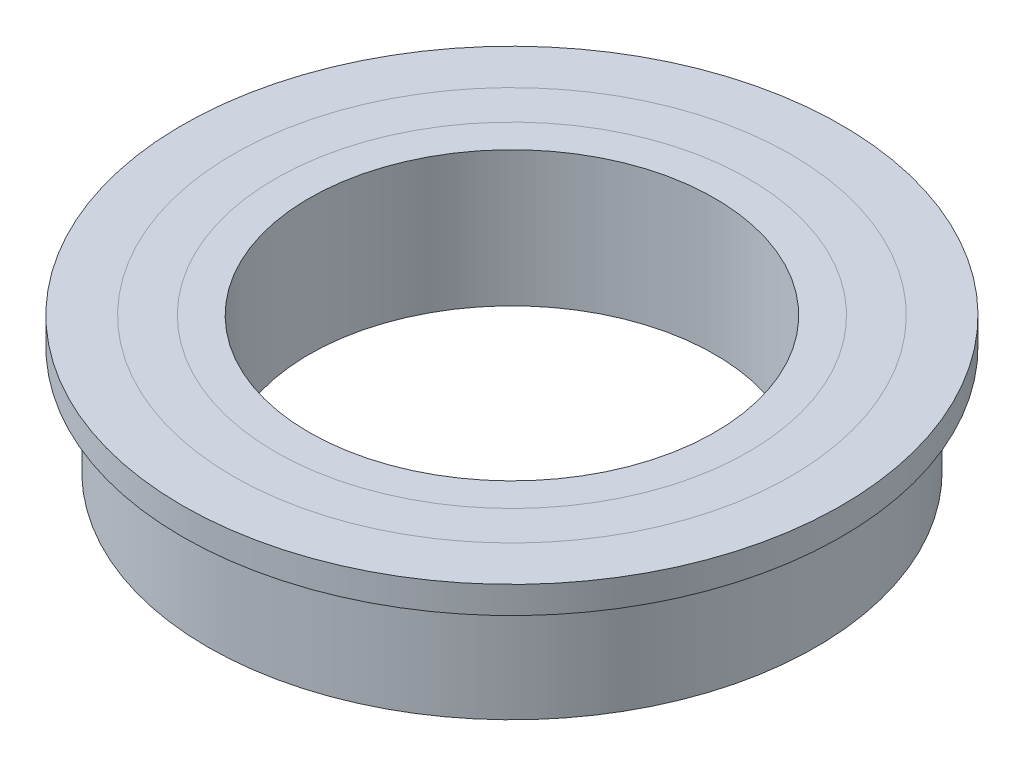
from build123d import *

# Parameters (mm, degrees)
SKETCH_1_R                   = 9
SKETCH_1_R_2                 = 6
EXTRUDE_1_DEPTH              = 4
EXTRUDE_START                = -0.8
SKETCH_2_R                   = 9.75
SKETCH_2_R_2                 = 6
EXTRUDE_2_DEPTH              = 0.8
SPLIT_BODIES_1_OUTLINE_R     = 8.25
SPLIT_BODIES_1_OUTLINE_R_2   = 7
SPLIT_BODIES_1_DEPTH         = 4
SPLIT_BODIES_1_2_OUTLINE_R   = 7
SPLIT_BODIES_1_2_OUTLINE_R_2 = 6
SPLIT_BODIES_1_2_DEPTH       = 4
SPLIT_BODIES_1_3_OUTLINE_R   = 8.25
SPLIT_BODIES_1_3_OUTLINE_R_2 = 6
SPLIT_BODIES_1_3_DEPTH       = 4


# Read off the part's stored shape, not the designer's step: 分割1
with BuildPart() as part:
    # 草图1 → 凸台-拉伸1 (new body)
    with BuildSketch(Plane(origin=(0, 0, 0), x_dir=(1, 0, 0), z_dir=(0, 1, 0))):
        with Locations(Location((0, 0, 0), (0, 0, 270))):
            Circle(SKETCH_1_R)
        with Locations(Location((0, 0, 0), (0, 0, 270))):
            Circle(SKETCH_1_R_2, mode=Mode.SUBTRACT)
    extrude(amount=EXTRUDE_1_DEPTH)

    # 草图2 → 凸台-拉伸2 (add)
    with BuildSketch(Plane(origin=(0, 4, 0), x_dir=(1, 0, 0), z_dir=(0, 1, 0)).offset(EXTRUDE_START)):
        with Locations(Location((0, 0, 0), (0, 0, 270))):
            Circle(SKETCH_2_R)
        with Locations(Location((0, 0, 0), (0, 0, 270))):
            Circle(SKETCH_2_R_2, mode=Mode.SUBTRACT)
    extrude(amount=EXTRUDE_2_DEPTH)

    # Split Bodies 1 3 outline → Split Bodies 1 3 (cut)
    with BuildSketch(Plane(origin=(0, 0, 0), x_dir=(1, 0, 0), z_dir=(0, 1, 0))):
        Circle(SPLIT_BODIES_1_3_OUTLINE_R)
        Circle(SPLIT_BODIES_1_3_OUTLINE_R_2, mode=Mode.SUBTRACT)
    extrude(amount=SPLIT_BODIES_1_3_DEPTH, mode=Mode.SUBTRACT)


with BuildPart() as body_2:
    # Split Bodies 1 outline → Split Bodies 1 (new body)
    with BuildSketch(Plane(origin=(0, 0, 0), x_dir=(1, 0, 0), z_dir=(0, 1, 0))):
        Circle(SPLIT_BODIES_1_OUTLINE_R)
        Circle(SPLIT_BODIES_1_OUTLINE_R_2, mode=Mode.SUBTRACT)
    extrude(amount=SPLIT_BODIES_1_DEPTH)


with BuildPart() as body_3:
    # Split Bodies 1 2 outline → Split Bodies 1 2 (new body)
    with BuildSketch(Plane(origin=(0, 0, 0), x_dir=(1, 0, 0), z_dir=(0, 1, 0))):
        Circle(SPLIT_BODIES_1_2_OUTLINE_R)
        Circle(SPLIT_BODIES_1_2_OUTLINE_R_2, mode=Mode.SUBTRACT)
    extrude(amount=SPLIT_BODIES_1_2_DEPTH)


solid = Compound([part.part, body_2.part, body_3.part])
